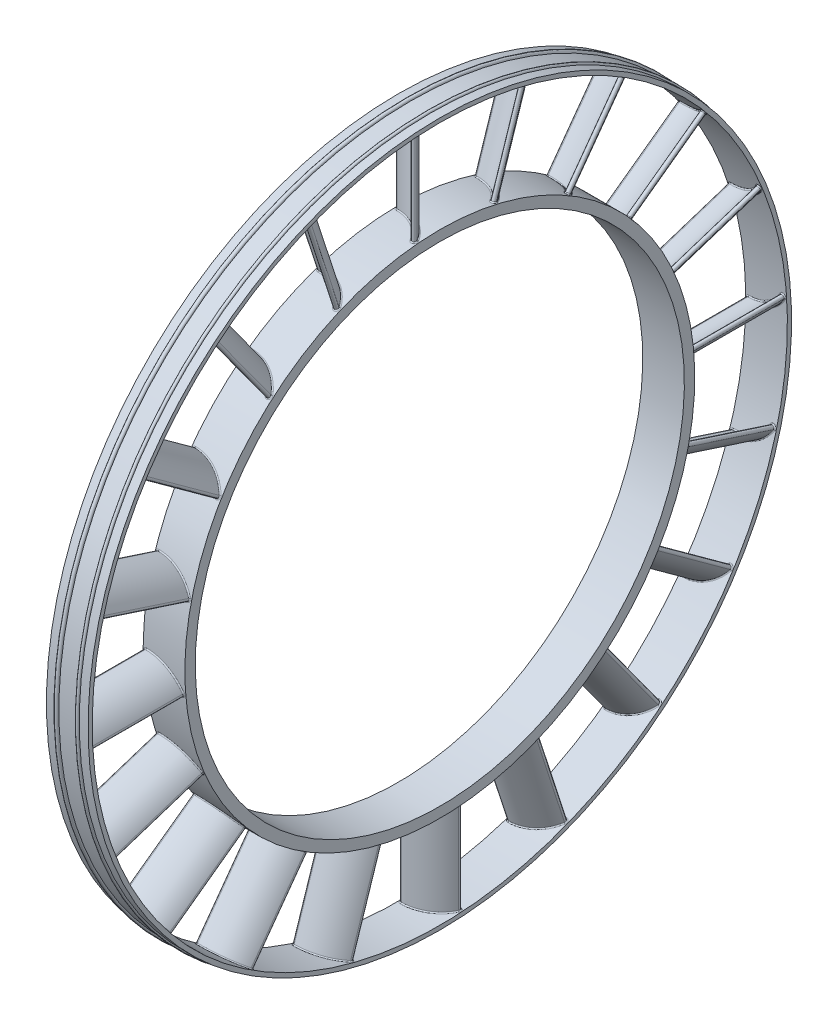
from build123d import *

# Parameters (mm, degrees)
SKETCH1_W                = 20
SKETCH1_H                = 5
BOSS_EXTRUDE1_REACH      = 361.096
BOSS_EXTRUDE1_END_RADIUS = 167
BOSS_EXTRUDE1_START      = 118.5
FILLET1_R                = 0.5
CIRPATTERN1_COUNT        = 20
FILLET1_OF_CIRPATTERN1_R = 0.5


with BuildPart() as part:
    # Sketch1 → Revolve1 (revolve)
    with BuildSketch(Plane.XY):
        with Locations((0, 120)):
            Rectangle(SKETCH1_W, SKETCH1_H)
        with BuildLine():
            Line((-10, 169), (-10, 167))
            Line((-10, 167), (10, 167))
            Line((10, 167), (10, 169))
            Line((10, 169), (5.78, 169))
            ThreePointArc((5.78, 169), (5, 169.78), (4.22, 169))
            Line((4.22, 169), (-4.02, 169))
            ThreePointArc((-4.02, 169), (-5, 169.98), (-5.98, 169))
            Line((-5.98, 169), (-10, 169))
        make_face()
    revolve(axis=Axis((75.6030005, 0, 0), (-1, 0, 0)))

    # Boss-Extrude1: up to this cylinder (the profile starts inside it)
    boss_extrude1_end = Plane(origin=(0.611719, 0, 0), z_dir=(1, 0, 0)) * Cylinder(BOSS_EXTRUDE1_END_RADIUS, 1057.192, mode=Mode.PRIVATE)
    # Sketch2 → Boss-Extrude1 (add, up to the surface)
    with BuildSketch(Plane(origin=(0, 0, 0), x_dir=(1, 0, 0), z_dir=(0, 1, 0)).offset(BOSS_EXTRUDE1_START), mode=Mode.PRIVATE) as boss_extrude1_sk1:
        with BuildLine():
            ThreePointArc((-8.5, 0), (1.601808083, -2.634335854), (9, -10))
            ThreePointArc((9, -10), (8.633911401, -11.366008469), (7.267902932, -10.99991987))
            ThreePointArc((7.267902932, -10.99991987), (0.609530207, -4.370822138), (-8.482097068, -1.99991987))
            ThreePointArc((-8.482097068, -1.99991987), (-9.491008469, -1.008911401), (-8.5, 0))
        make_face()
    boss_extrude1_tool1 = extrude(boss_extrude1_sk1.sketch, amount=BOSS_EXTRUDE1_REACH, mode=Mode.PRIVATE) & boss_extrude1_end
    boss_extrude1 = boss_extrude1_tool1.solids().sort_by_distance((0.611719, 118.5, 4.366992))[0]
    add(boss_extrude1)

    # Fillet1
    fillet1_edges = [part.edges().sort_by_distance(p)[0] for p in [
        (1.758794606, 166.977766321, 2.724988686),
        (8.634640504, 166.612794914, 11.365587143),
        (0.611926825, 166.942756492, 4.372191882),
        (-9.491008363, 166.99695229, 1.00892319),
        (-9.491008272, 122.495845046, 1.008933313),
        (8.635268848, 121.971643, 11.365223446),
        (1.760468535, 122.46966612, 2.725965558),
        (0.613993286, 122.421908219, 4.37337332),
    ]]
    fillet(fillet1_edges, radius=FILLET1_R)

    # CirPattern1: Boss-Extrude1 ×20 about axis
    cirpattern1_axis = Axis((10, 0, 0), (1, 0, 0))
    for i in range(1, CIRPATTERN1_COUNT):
        add(boss_extrude1.rotate(cirpattern1_axis, i * 360 / CIRPATTERN1_COUNT))

    # Fillet1 of CirPattern1
    fillet1_of_cirpattern1_edges = [part.edges().sort_by_distance(p)[0] for p in [
        (1.758794606, 157.963224923, 54.190585723),
        (8.634640504, 154.946024722, 62.295500822),
        (0.611926825, 157.420914816, 55.746350424),
        (-9.491008363, 158.511765265, 52.56443924),
        (-9.491008272, 116.188694111, 38.812850461),
        (8.635268848, 112.489878689, 48.500280336),
        (1.760468535, 115.633204328, 40.437755434),
        (0.613993286, 115.078706871, 41.989775318),
        (1.758794606, 133.486142475, 100.351630661),
        (8.634640504, 128.112058059, 107.127496843),
        (0.611926825, 132.489617182, 101.663667779),
        (-9.491008363, 134.51034224, 98.97458174),
        (-9.491008272, 98.508184261, 72.817495381),
        (8.635268848, 91.996821288, 80.887791866),
        (1.760468535, 97.477758833, 74.191216061),
        (0.613993286, 96.470799893, 75.495925547),
        (1.758794606, 95.942506348, 136.689558799),
        (8.634640504, 88.737590544, 141.473107072),
        (0.611926825, 94.589312708, 137.629436999),
        (-9.491008363, 97.342109727, 135.696402583),
        (-9.491008272, 71.185006989, 99.694256504),
        (8.635268848, 62.498474041, 105.35744275),
        (1.760468535, 69.780511136, 100.68232354),
        (0.613993286, 68.41965887, 101.612008574),
        (1.758794606, 49.00734923, 159.64736055),
        (8.634640504, 40.676869395, 161.970343879),
        (0.611926825, 47.429947264, 160.123078005),
        (-9.491008363, 50.645353292, 159.135314088),
        (-9.491008272, 36.893745258, 116.81224919),
        (8.635268848, 26.882340701, 119.513973068),
        (1.760468535, 35.252660819, 117.317943695),
        (0.613993286, 33.671124929, 117.781600228),
        (1.758794606, -2.724988686, 166.977766321),
        (8.634640504, -11.365587143, 166.612794914),
        (0.611926825, -4.372191882, 166.942756492),
        (-9.491008363, -1.00892319, 166.99695229),
        (-9.491008272, -1.008933313, 122.495845046),
        (8.635268848, -11.365223446, 121.971643),
        (1.760468535, -2.725965558, 122.46966612),
        (0.613993286, -4.37337332, 122.421908219),
        (1.758794606, -54.190585723, 157.963224923),
        (8.634640504, -62.295500822, 154.946024722),
        (0.611926825, -55.746350424, 157.420914816),
        (-9.491008363, -52.56443924, 158.511765265),
        (-9.491008272, -38.812850461, 116.188694111),
        (8.635268848, -48.500280336, 112.489878689),
        (1.760468535, -40.437755434, 115.633204328),
        (0.613993286, -41.989775318, 115.078706871),
        (1.758794606, -100.351630661, 133.486142475),
        (8.634640504, -107.127496843, 128.112058059),
        (0.611926825, -101.663667779, 132.489617182),
        (-9.491008363, -98.97458174, 134.51034224),
        (-9.491008272, -72.817495381, 98.508184261),
        (8.635268848, -80.887791866, 91.996821288),
        (1.760468535, -74.191216061, 97.477758833),
        (0.613993286, -75.495925547, 96.470799893),
        (1.758794606, -136.689558799, 95.942506348),
        (8.634640504, -141.473107072, 88.737590544),
        (0.611926825, -137.629436999, 94.589312708),
        (-9.491008363, -135.696402583, 97.342109727),
        (-9.491008272, -99.694256504, 71.185006989),
        (8.635268848, -105.35744275, 62.498474041),
        (1.760468535, -100.68232354, 69.780511136),
        (0.613993286, -101.612008574, 68.41965887),
        (1.758794606, -159.64736055, 49.00734923),
        (8.634640504, -161.970343879, 40.676869395),
        (0.611926825, -160.123078005, 47.429947264),
        (-9.491008363, -159.135314088, 50.645353292),
        (-9.491008272, -116.81224919, 36.893745258),
        (8.635268848, -119.513973068, 26.882340701),
        (1.760468535, -117.317943695, 35.252660819),
        (0.613993286, -117.781600228, 33.671124929),
        (1.758794606, -166.977766321, -2.724988686),
        (8.634640504, -166.612794914, -11.365587143),
        (0.611926825, -166.942756492, -4.372191882),
        (-9.491008363, -166.99695229, -1.00892319),
        (-9.491008272, -122.495845046, -1.008933313),
        (8.635268848, -121.971643, -11.365223446),
        (1.760468535, -122.46966612, -2.725965558),
        (0.613993286, -122.421908219, -4.37337332),
        (1.758794606, -157.963224923, -54.190585723),
        (8.634640504, -154.946024722, -62.295500822),
        (0.611926825, -157.420914816, -55.746350424),
        (-9.491008363, -158.511765265, -52.56443924),
        (-9.491008272, -116.188694111, -38.812850461),
        (8.635268848, -112.489878689, -48.500280336),
        (1.760468535, -115.633204328, -40.437755434),
        (0.613993286, -115.078706871, -41.989775318),
        (1.758794606, -133.486142475, -100.351630661),
        (8.634640504, -128.112058059, -107.127496843),
        (0.611926825, -132.489617182, -101.663667779),
        (-9.491008363, -134.51034224, -98.97458174),
        (-9.491008272, -98.508184261, -72.817495381),
        (8.635268848, -91.996821288, -80.887791866),
        (1.760468535, -97.477758833, -74.191216061),
        (0.613993286, -96.470799893, -75.495925547),
        (1.758794606, -95.942506348, -136.689558799),
        (8.634640504, -88.737590544, -141.473107072),
        (0.611926825, -94.589312708, -137.629436999),
        (-9.491008363, -97.342109727, -135.696402583),
        (-9.491008272, -71.185006989, -99.694256504),
        (8.635268848, -62.498474041, -105.35744275),
        (1.760468535, -69.780511136, -100.68232354),
        (0.613993286, -68.41965887, -101.612008574),
        (1.758794606, -49.00734923, -159.64736055),
        (8.634640504, -40.676869395, -161.970343879),
        (0.611926825, -47.429947264, -160.123078005),
        (-9.491008363, -50.645353292, -159.135314088),
        (-9.491008272, -36.893745258, -116.81224919),
        (8.635268848, -26.882340701, -119.513973068),
        (1.760468535, -35.252660819, -117.317943695),
        (0.613993286, -33.671124929, -117.781600228),
        (1.758794606, 2.724988686, -166.977766321),
        (8.634640504, 11.365587143, -166.612794914),
        (0.611926825, 4.372191882, -166.942756492),
        (-9.491008363, 1.00892319, -166.99695229),
        (-9.491008272, 1.008933313, -122.495845046),
        (8.635268848, 11.365223446, -121.971643),
        (1.760468535, 2.725965558, -122.46966612),
        (0.613993286, 4.37337332, -122.421908219),
        (1.758794606, 54.190585723, -157.963224923),
        (8.634640504, 62.295500822, -154.946024722),
        (0.611926825, 55.746350424, -157.420914816),
        (-9.491008363, 52.56443924, -158.511765265),
        (-9.491008272, 38.812850461, -116.188694111),
        (8.635268848, 48.500280336, -112.489878689),
        (1.760468535, 40.437755434, -115.633204328),
        (0.613993286, 41.989775318, -115.078706871),
        (1.758794606, 100.351630661, -133.486142475),
        (8.634640504, 107.127496843, -128.112058059),
        (0.611926825, 101.663667779, -132.489617182),
        (-9.491008363, 98.97458174, -134.51034224),
        (-9.491008272, 72.817495381, -98.508184261),
        (8.635268848, 80.887791866, -91.996821288),
        (1.760468535, 74.191216061, -97.477758833),
        (0.613993286, 75.495925547, -96.470799893),
        (1.758794606, 136.689558799, -95.942506348),
        (8.634640504, 141.473107072, -88.737590544),
        (0.611926825, 137.629436999, -94.589312708),
        (-9.491008363, 135.696402583, -97.342109727),
        (-9.491008272, 99.694256504, -71.185006989),
        (8.635268848, 105.35744275, -62.498474041),
        (1.760468535, 100.68232354, -69.780511136),
        (0.613993286, 101.612008574, -68.41965887),
        (1.758794606, 159.64736055, -49.00734923),
        (8.634640504, 161.970343879, -40.676869395),
        (0.611926825, 160.123078005, -47.429947264),
        (-9.491008363, 159.135314088, -50.645353292),
        (-9.491008272, 116.81224919, -36.893745258),
        (8.635268848, 119.513973068, -26.882340701),
        (1.760468535, 117.317943695, -35.252660819),
        (0.613993286, 117.781600228, -33.671124929),
    ]]
    fillet(fillet1_of_cirpattern1_edges, radius=FILLET1_OF_CIRPATTERN1_R)


solid = part.part
